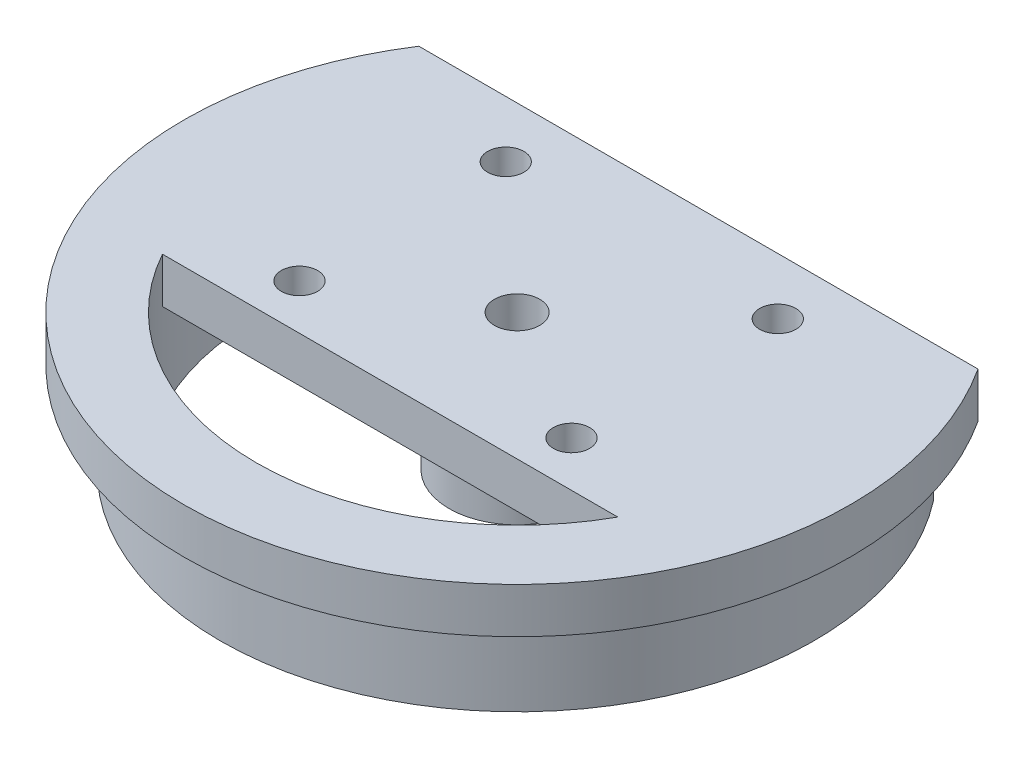
from build123d import *

# Parameters (mm, degrees)
CYLINDER_DEPTH          = 5
CYLINDER_DEPTH_BACK     = 10
SKETCH_1_R              = 7.5
SKETCH_1_R_2            = 2.5
SKETCH_2_R              = 36.75
SKETCH_2_R_2            = 2.5
BASE_HORIZONT_DEPTH     = 5
SKETCH_3_R              = 32.75
SKETCH_3_R_2            = 28.75
EDGE_2_DEPTH            = 15
PIE_REACH               = 56.094
CUTOFF_DEPTH            = 10
CUTOFF_DEPTH_BACK       = 10
SKETCH_8_W              = 61.662387238
SKETCH_8_H              = 16.75
MAIN_HORNS_HOLES_REACH  = 56.094
SKETCH_4_R              = 2
MINOR_HORNS_HOLES_REACH = 56.094
SKETCH_11_R             = 2


with BuildPart() as part:
    # Эскиз1 → cylinder (new, two sides: drawn at the far end of the back side and taken through both)
    with BuildSketch(Plane(origin=(0, 0, 0), x_dir=(1, 0, 0), z_dir=(0, 1, 0)).offset(-CYLINDER_DEPTH_BACK)):
        Circle(SKETCH_1_R)
        Circle(SKETCH_1_R_2, mode=Mode.SUBTRACT)
    extrude(amount=CYLINDER_DEPTH + CYLINDER_DEPTH_BACK)

    # Эскиз2 → base horizont (add)
    with BuildSketch(Plane(origin=(0, 0, 0), x_dir=(1, 0, 0), z_dir=(0, 1, 0))):
        Circle(SKETCH_2_R)
        Circle(SKETCH_2_R_2, mode=Mode.SUBTRACT)
    extrude(amount=BASE_HORIZONT_DEPTH)

    # Эскиз3 → edge 2 (add)
    with BuildSketch(Plane(origin=(0, 5, 0), x_dir=(1, 0, 0), z_dir=(0, 1, 0))):
        Circle(SKETCH_3_R)
        Circle(SKETCH_3_R_2, mode=Mode.SUBTRACT)
    extrude(amount=-EDGE_2_DEPTH)

    # Эскиз10 → pie (cut, up to next)
    with BuildSketch(Plane(origin=(0, 5, 0), x_dir=(1, 0, 0), z_dir=(0, 1, 0)), mode=Mode.PRIVATE) as pie_sk1:
        with BuildLine():
            Line((-25.111003564, -14), (25.111003564, -14))
            ThreePointArc((25.111003564, -14), (0, -28.75), (-25.111003564, -14))
        make_face()
    pie_tool1 = extrude(pie_sk1.sketch, amount=-PIE_REACH, mode=Mode.PRIVATE) & part.part
    add(pie_tool1.solids().sort_by_distance((0, 5, 20.052651))[0], mode=Mode.SUBTRACT)

    # Эскиз8 → cutoff (cut, two sides: drawn at the far end of the back side and taken through both)
    with BuildSketch(Plane(origin=(0, 0, 0), x_dir=(1, 0, 0), z_dir=(0, 1, 0)).offset(-CUTOFF_DEPTH_BACK)):
        with Locations((0, 28.375)):
            Rectangle(SKETCH_8_W, SKETCH_8_H)
    extrude(amount=CUTOFF_DEPTH + CUTOFF_DEPTH_BACK, mode=Mode.SUBTRACT)

    # Эскиз4 → main horns holes (cut, up to next)
    with BuildSketch(Plane(origin=(0, 5, 0), x_dir=(1, 0, 0), z_dir=(0, 1, 0)), mode=Mode.PRIVATE) as main_horns_holes_sk1:
        with Locations((-15, 13.75)):
            Circle(SKETCH_4_R)
    main_horns_holes_tool1 = extrude(main_horns_holes_sk1.sketch, amount=-MAIN_HORNS_HOLES_REACH, mode=Mode.PRIVATE) & part.part
    # Эскиз4 → main horns holes (cut, up to next)
    with BuildSketch(Plane(origin=(0, 5, 0), x_dir=(1, 0, 0), z_dir=(0, 1, 0)), mode=Mode.PRIVATE) as main_horns_holes_sk2:
        with Locations((15, 13.75)):
            Circle(SKETCH_4_R)
    main_horns_holes_tool2 = extrude(main_horns_holes_sk2.sketch, amount=-MAIN_HORNS_HOLES_REACH, mode=Mode.PRIVATE) & part.part
    add(main_horns_holes_tool1.solids().sort_by_distance((-15, 5, -13.75))[0], mode=Mode.SUBTRACT)
    add(main_horns_holes_tool2.solids().sort_by_distance((15, 5, -13.75))[0], mode=Mode.SUBTRACT)

    # Эскиз11 → minor horns holes (cut, up to next)
    with BuildSketch(Plane(origin=(0, 5, 0), x_dir=(1, 0, 0), z_dir=(0, 1, 0)), mode=Mode.PRIVATE) as minor_horns_holes_sk1:
        with Locations((-15, -9)):
            Circle(SKETCH_11_R)
    minor_horns_holes_tool1 = extrude(minor_horns_holes_sk1.sketch, amount=-MINOR_HORNS_HOLES_REACH, mode=Mode.PRIVATE) & part.part
    # Эскиз11 → minor horns holes (cut, up to next)
    with BuildSketch(Plane(origin=(0, 5, 0), x_dir=(1, 0, 0), z_dir=(0, 1, 0)), mode=Mode.PRIVATE) as minor_horns_holes_sk2:
        with Locations((15, -9)):
            Circle(SKETCH_11_R)
    minor_horns_holes_tool2 = extrude(minor_horns_holes_sk2.sketch, amount=-MINOR_HORNS_HOLES_REACH, mode=Mode.PRIVATE) & part.part
    add(minor_horns_holes_tool1.solids().sort_by_distance((-15, 5, 9))[0], mode=Mode.SUBTRACT)
    add(minor_horns_holes_tool2.solids().sort_by_distance((15, 5, 9))[0], mode=Mode.SUBTRACT)


solid = part.part
